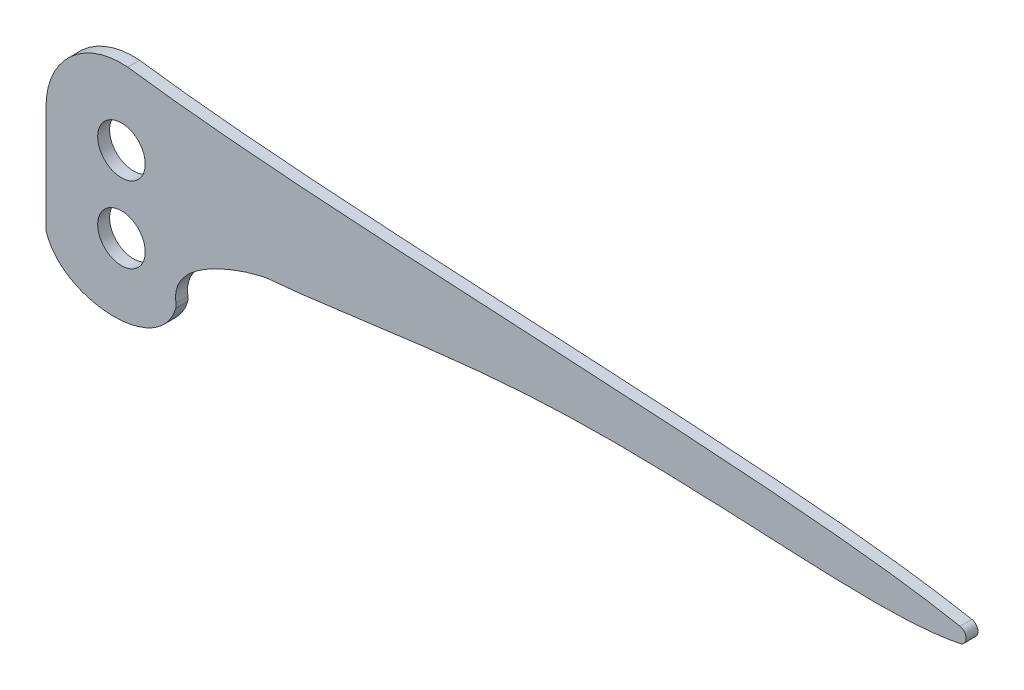
from build123d import *

# Parameters (mm, degrees)
SKETCH1_R           = 7.9375
BOSS_EXTRUDE1_DEPTH = 3.96875
SCALE1_SCALE        = 0.75


with BuildPart() as part:
    # Sketch1 → Boss-Extrude1 (new body)
    with BuildSketch(Plane.XY):
        with BuildLine():
            ThreePointArc((2.090204907, 25.105012471), (-17.058347301, 18.537621075), (-25.191875828, 0))
            Line((-25.191875828, 0), (-25.191875828, -35.215356132))
            ThreePointArc((-25.191875828, -35.215356132), (-25.144594979, -35.781140778), (-25.004063999, -36.331230578))
            add(Edge.make_bspline(
                [(-25.004063999, -36.331230578), (-24.302161584, -38.357321078), (-17.500345693, -49.472928078), (6.486565439, -52.353017034), (16.828257208, -40.890808587), (18.117618202, -36.640731795)],
                knots=[0.011286064, 0.011286064, 0.011286064, 0.011286064, 0.130987572, 0.750185474, 0.983991621, 0.983991621, 0.983991621, 0.983991621], degree=3))
            ThreePointArc((18.117618202, -36.640731795), (18.258374718, -35.854153527), (18.212152653, -35.056418427))
            add(Edge.make_bspline(
                [(18.212152653, -35.056418427), (15.722327617, -21.003254002), (45.083704914, -12.577387864), (50.314621311, -12.487786805)],
                knots=[0.243688719, 0.243688719, 0.243688719, 0.243688719, 1, 1, 1, 1], degree=3))
            add(Edge.make_bspline(
                [(50.314621311, -12.487786805), (67.828969762, -11.217353563), (162.851239243, 6.097445829), (250.038282618, -9.041784468), (279.934807735, -2.602592093)],
                knots=[0.23584572, 0.23584572, 0.23584572, 0.23584572, 0.495200792, 0.941477437, 0.941477437, 0.941477437, 0.941477437], degree=3))
            ThreePointArc((279.934807735, -2.602592093), (281.939894054, -0.09633433), (279.889362488, 2.372880002))
            add(Edge.make_bspline(
                [(2.090204907, 25.105012471), (29.372633882, 21.318909318), (128.041674084, 14.540572725), (239.548411309, 10.293455518), (279.889362488, 2.372880002)],
                knots=[0.008543469, 0.008543469, 0.008543469, 0.008543469, 0.340594684, 0.94139515, 0.94139515, 0.94139515, 0.94139515], degree=3))
        make_face()
        with Locations((0, -25.4)):
            Circle(SKETCH1_R, mode=Mode.SUBTRACT)
        Circle(SKETCH1_R, mode=Mode.SUBTRACT)
    extrude(amount=BOSS_EXTRUDE1_DEPTH)


with BuildPart() as part_1:
    # Scale1: scaled about (77.459718125, -1.436602642, 1.984375)
    add(part.part.scale(SCALE1_SCALE).moved(Location((19.364929531, -0.35915066, 0.49609375))))


solid = part_1.part
